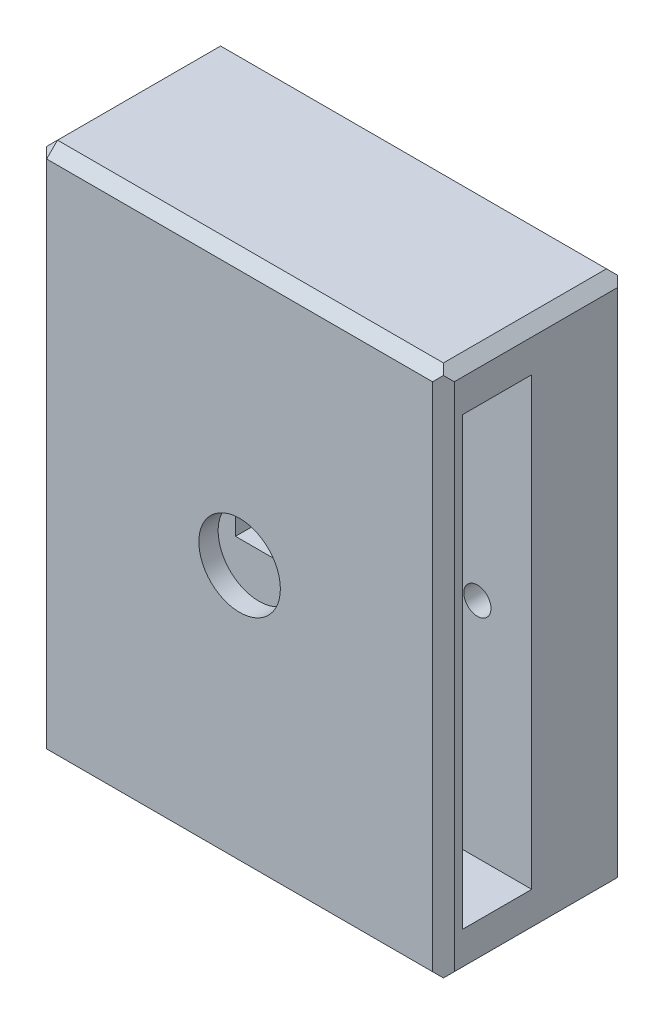
from build123d import *

# Parameters (mm, degrees)
SKETCH1_W           = 50
SKETCH1_H           = 25
BOSS_EXTRUDE1_DEPTH = 49
CUT_EXTRUDE2_DEPTH  = 55
SKETCH5_R           = 1.25
SKETCH5_W           = 19.5
SKETCH5_H           = 12
CUT_EXTRUDE3_DEPTH  = 12.5
SKETCH7_W           = 50
SKETCH7_H           = 49
CUT_EXTRUDE4_DEPTH  = 8
CHAMFER1_SIZE       = 1
SKETCH8_W           = 17.539951448
SKETCH8_H           = 49.569428005
CUT_EXTRUDE5_DEPTH  = 12.5
CHAMFER2_SIZE       = 1
SKETCH9_R           = 3.75
CUT_EXTRUDE6_DEPTH  = 4


with BuildPart() as part:
    # Sketch1 → Boss-Extrude1 (new body)
    with BuildSketch(Plane(origin=(0, 0, 0), x_dir=(1, 0, 0), z_dir=(0, 1, 0))):
        with Locations((25, 12.5)):
            Rectangle(SKETCH1_W, SKETCH1_H)
    extrude(amount=BOSS_EXTRUDE1_DEPTH)

    # Sketch4 → Cut-Extrude2 (cut)
    with BuildSketch(Plane(origin=(50, 0, 0), x_dir=(0, 0, -1), z_dir=(1, 0, 0))):
        Polygon((9.775, 45), (16.125, 45), (16.125, 34.127502784), (16.125, 12.627502784), (16.125, 4), (9.775, 4), (9.775, 13.75), (9.775, 35.25), align=None)
    extrude(amount=-CUT_EXTRUDE2_DEPTH, mode=Mode.SUBTRACT)

    # Sketch5 → Cut-Extrude3 (cut)
    with BuildSketch(Plane(origin=(0, 0, -25), x_dir=(-1, 0, 0), z_dir=(0, 0, -1))):
        with Locations((-32.5, 24.5)):
            Circle(SKETCH5_R)
        with Locations((-7.5, 24.5)):
            Circle(SKETCH5_R)
        with Locations((-20, 24.5)):
            Rectangle(SKETCH5_W, SKETCH5_H)
    extrude(amount=-CUT_EXTRUDE3_DEPTH, mode=Mode.SUBTRACT)

    # Sketch7 → Cut-Extrude4 (cut)
    with BuildSketch(Plane.XY):
        with Locations((25, 24.5)):
            Rectangle(SKETCH7_W, SKETCH7_H)
    extrude(amount=-CUT_EXTRUDE4_DEPTH, mode=Mode.SUBTRACT)

    # Chamfer1
    chamfer1_edges = [part.edges().sort_by_distance(p)[0] for p in [
        (25, 49, -25),
        (0, 49, -16.5),
        (25, 0, -25),
        (0, 0, -16.5),
        (50, 0, -16.5),
        (50, 49, -16.5),
        (0, 24.5, -8),
        (25, 49, -8),
        (50, 24.5, -8),
        (25, 0, -8),
        (0, 24.5, -25),
        (50, 24.5, -25),
    ]]
    chamfer(chamfer1_edges, length=CHAMFER1_SIZE)

    # Sketch8 → Cut-Extrude5 (cut)
    with BuildSketch(Plane(origin=(50, 0, 0), x_dir=(0, 0, -1), z_dir=(1, 0, 0))):
        with Locations((16.404674177, 24.368191016)):
            Rectangle(SKETCH8_W, SKETCH8_H)
    extrude(amount=-CUT_EXTRUDE5_DEPTH, mode=Mode.SUBTRACT)

    # Chamfer2
    # the kernel refuses this chamfer: 1 mm, written as the material it takes off along each edge
    with BuildSketch(Plane(origin=(37.5, 0, -6.428317012), x_dir=(-0.9996219169112968, -0.027495876610586292, 0), z_dir=(0, 0, -1))) as chamfer2_piece_1:
        Polygon((CHAMFER2_SIZE * 0.999621916911, CHAMFER2_SIZE * 0.0274958766106), (-CHAMFER2_SIZE * 0.0274958766106, CHAMFER2_SIZE * 0.999621916911), (0, 0), align=None)
    extrude(amount=20.143365976, mode=Mode.SUBTRACT)
    with BuildSketch(Plane(origin=(37.5, 49, -6.428317012), x_dir=(-0.9996219169112968, 0.027495876610589005, 0), z_dir=(0, 0, -1))) as chamfer2_piece_2:
        Polygon((CHAMFER2_SIZE * 0.999621916911, -CHAMFER2_SIZE * 0.0274958766106), (-CHAMFER2_SIZE * 0.0274958766106, -CHAMFER2_SIZE * 0.999621916911), (0, 0), align=None)
    extrude(amount=20.143365976, mode=Mode.SUBTRACT)
    with BuildSketch(Plane(origin=(37.5, 50.571682988, -8), x_dir=(-0.9996219169112968, 0, 0.027495876610586414), z_dir=(0, -1, 0)), Plane(origin=(37.5, -1.571682988, -25), x_dir=(-0.9996219169112968, 0, -0.02749587661058555), z_dir=(0, 1, 0))) as chamfer2_piece_3:
        Polygon((CHAMFER2_SIZE * 0.999621916911, CHAMFER2_SIZE * 0.0274958766106), (-CHAMFER2_SIZE * 0.0274958766106, CHAMFER2_SIZE * 0.999621916911), (0, 0), align=None)
    extrude(amount=52.143365976, mode=Mode.SUBTRACT)

    # Sketch9 → Cut-Extrude6 (cut)
    with BuildSketch(Plane.XY.offset(-8)):
        with Locations((18.75, 24.5)):
            Circle(SKETCH9_R)
    extrude(amount=-CUT_EXTRUDE6_DEPTH, mode=Mode.SUBTRACT)


solid = part.part
